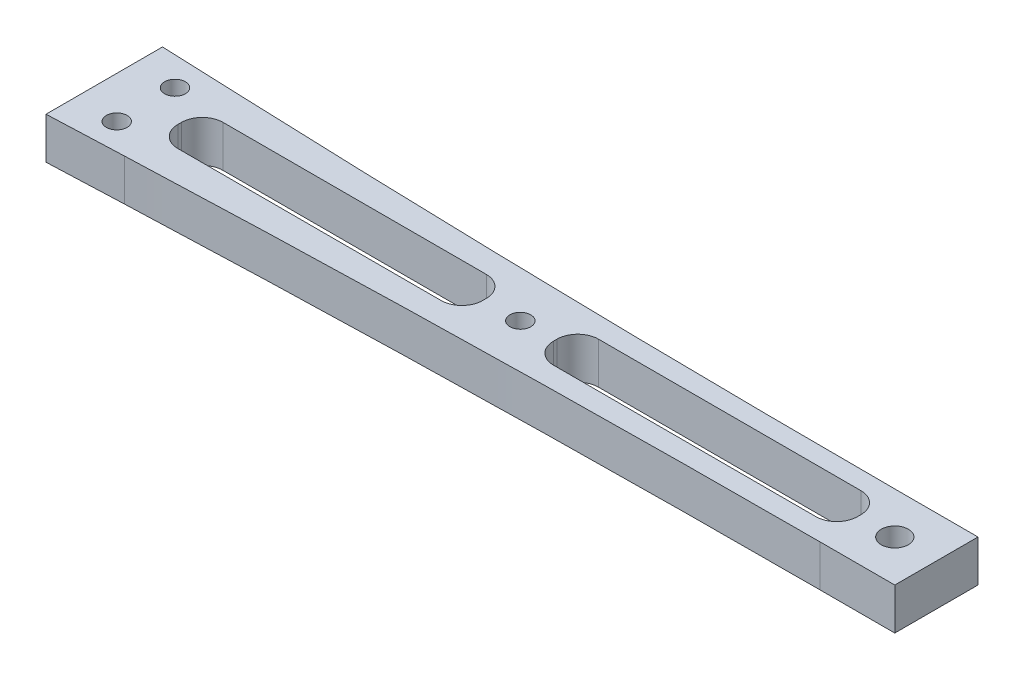
from build123d import *

# Parameters (mm, degrees)
SZKIC1_R                    = 1.97098021
SZKIC1_R_2                  = 3.25
SZKIC1_R_3                  = 2.5
DODANIE_WYCI_GNI_CIE1_DEPTH = 10
ZAOKR_GLENIE1_R             = 4100
OTW_R_GWINTOWANY_M62_D      = 5
OTW_R_GWINTOWANY_M62_DEPTH  = 15.497848452
OTW_R_GWINTOWANY_M62_TIP    = 1.502151548


with BuildPart() as part:
    # Szkic1 → Dodanie-wyciągnięcie1 (new body)
    with BuildSketch(Plane(origin=(0, 0, 0), x_dir=(1, 0, 0), z_dir=(0, 1, 0))):
        Polygon((200, 0), (200, 20), (100, 20), (0, 24), (0, -4), (100, 0), align=None)
        with Locations(Location((100, 10, 0), (0, 0, 270))):
            Circle(SZKIC1_R, mode=Mode.SUBTRACT)
        with Locations(Location((190, 10, 0), (0, 0, 270))):
            Circle(SZKIC1_R_2, mode=Mode.SUBTRACT)
        with Locations(Location((10, 17, 0), (0, 0, 270))):
            Circle(SZKIC1_R_3, mode=Mode.SUBTRACT)
        with Locations(Location((10, 3, 0), (0, 0, 270))):
            Circle(SZKIC1_R_3, mode=Mode.SUBTRACT)
        with BuildLine():
            Line((22.984822323, 15.57457628), (86.25939238, 15.57457628))
            ThreePointArc((86.25939238, 15.57457628), (89.794926286, 14.110110186), (91.25939238, 10.57457628))
            Line((91.25939238, 10.57457628), (91.25939238, 9.696719379))
            ThreePointArc((91.25939238, 9.696719379), (89.794926286, 6.161185473), (86.25939238, 4.696719379))
            Line((86.25939238, 4.696719379), (22.984822323, 4.696719379))
            ThreePointArc((22.984822323, 4.696719379), (19.449288417, 6.161185473), (17.984822323, 9.696719379))
            Line((17.984822323, 9.696719379), (17.984822323, 10.57457628))
            ThreePointArc((17.984822323, 10.57457628), (19.449288417, 14.110110186), (22.984822323, 15.57457628))
        make_face(mode=Mode.SUBTRACT)
        with BuildLine():
            Line((113.225148066, 15.57457628), (176.286209663, 15.57457628))
            ThreePointArc((176.286209663, 15.57457628), (179.821743569, 14.110110186), (181.286209663, 10.57457628))
            Line((181.286209663, 10.57457628), (181.286209663, 9.752776346))
            ThreePointArc((181.286209663, 9.752776346), (179.821743569, 6.21724244), (176.286209663, 4.752776346))
            Line((176.286209663, 4.752776346), (113.225148066, 4.752776346))
            ThreePointArc((113.225148066, 4.752776346), (109.68961416, 6.21724244), (108.225148066, 9.752776346))
            Line((108.225148066, 9.752776346), (108.225148066, 10.57457628))
            ThreePointArc((108.225148066, 10.57457628), (109.68961416, 14.110110186), (113.225148066, 15.57457628))
        make_face(mode=Mode.SUBTRACT)
    extrude(amount=DODANIE_WYCI_GNI_CIE1_DEPTH)

    # Zaokrąglenie1
    # the kernel refuses this fillet: 4100 mm, written as the material it adds along each edge
    with BuildSketch(Plane(origin=(100, 0, -20), x_dir=(1, 0, 0), z_dir=(0, 1, 0)), Plane(origin=(100, 0, 0), x_dir=(-0.9992009587217893, 0, 0.03996803834887583), z_dir=(0, 1, 0))) as zaokr_glenie1_piece_1:
        with BuildLine():
            CenterArc((ZAOKR_GLENIE1_R * 0.0199920063936, ZAOKR_GLENIE1_R), ZAOKR_GLENIE1_R, 267.709389957, 2.290610043)
            Line((-ZAOKR_GLENIE1_R * 0.0199760319553, ZAOKR_GLENIE1_R * 0.000799041278211), (0, 0))
            Line((0, 0), (ZAOKR_GLENIE1_R * 0.0199920063936, 0))
        make_face()
    extrude(amount=10)

    # Otwór gwintowany M62
    with Locations(Plane(origin=(100, 10, -10), x_dir=(0, 0, 1), z_dir=(0, 1, 0))):
        with Locations((0, 0)):
            Hole(OTW_R_GWINTOWANY_M62_D / 2, depth=OTW_R_GWINTOWANY_M62_DEPTH)
            with Locations((0, 0, -(OTW_R_GWINTOWANY_M62_DEPTH + OTW_R_GWINTOWANY_M62_TIP / 2))):  # 118° drill point
                Cone(0, OTW_R_GWINTOWANY_M62_D / 2, OTW_R_GWINTOWANY_M62_TIP, mode=Mode.SUBTRACT)


solid = part.part
